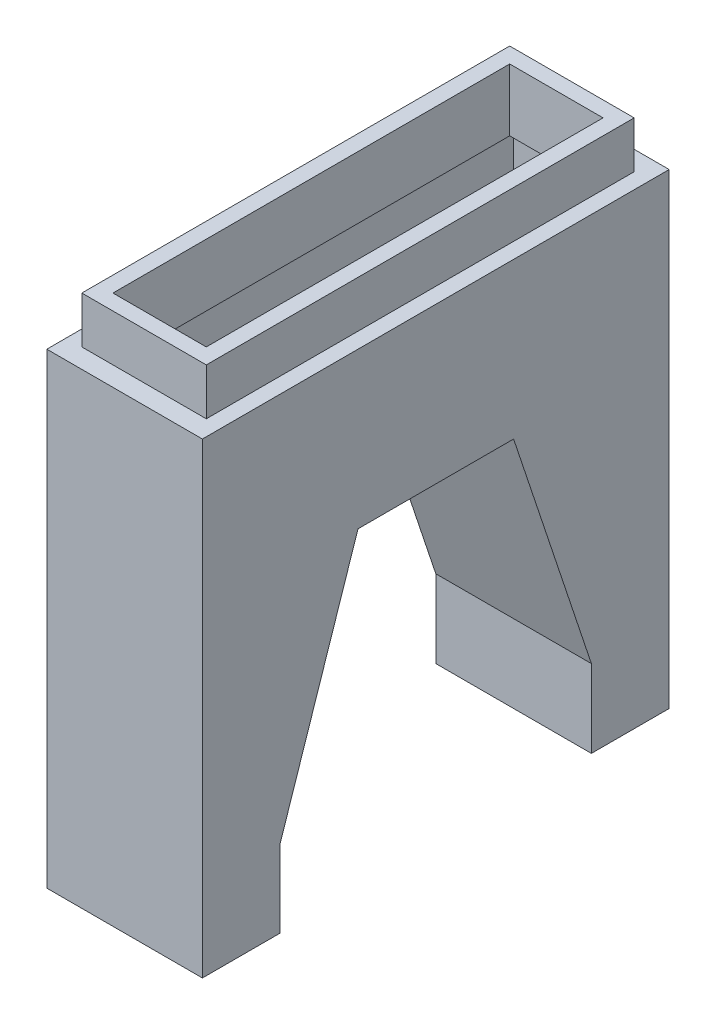
from build123d import *

# Parameters (mm, degrees)
SKETCH1_W           = 8
SKETCH1_H           = 27.5
BOSS_EXTRUDE1_DEPTH = 3
SKETCH2_W           = 10
SKETCH2_H           = 30
BOSS_EXTRUDE2_DEPTH = 10
SKETCH4_W           = 10
SKETCH4_H           = 5
BOSS_EXTRUDE3_DEPTH = 20
CHAMFER2_SIZE       = 5
CHAMFER2_SIZE2      = 15
SKETCH7_W           = 4
SKETCH7_H           = 5
CUT_EXTRUDE2_DEPTH  = 2
SHELL1_START        = -4
SHELL1_DEPTH        = 8
SHELL1_START_2      = -3
SHELL1_2_OUTLINE_W  = 4
SHELL1_2_OUTLINE_H  = 25.5
SHELL1_2_DEPTH      = 6
SHELL1_START_3      = -1
SHELL1_3_DEPTH      = 5


# Read off the part's stored shape, not the designer's step: Shell1
with BuildPart() as part:
    # Sketch1 → Boss-Extrude1 (new body)
    with BuildSketch(Plane(origin=(0, 0, 0), x_dir=(1, 0, 0), z_dir=(0, 1, 0))):
        Rectangle(SKETCH1_W, SKETCH1_H)
    extrude(amount=BOSS_EXTRUDE1_DEPTH)

    # Sketch2 → Boss-Extrude2 (add)
    with BuildSketch(Plane.XZ):
        Rectangle(SKETCH2_W, SKETCH2_H)
    extrude(amount=BOSS_EXTRUDE2_DEPTH)

    # Sketch4 → Boss-Extrude3 (add)
    with BuildSketch(Plane.XZ.offset(10)):
        with Locations((0, 12.5)):
            Rectangle(SKETCH4_W, SKETCH4_H)
        with Locations((0, -12.5)):
            Rectangle(SKETCH4_W, SKETCH4_H)
    extrude(amount=BOSS_EXTRUDE3_DEPTH)

    # Chamfer2
    chamfer2_edges = [part.edges().sort_by_distance(p)[0] for p in [
        (0, -10, 10),
        (0, -10, -10),
    ]]
    chamfer2_side = [part.faces().sort_by_distance(p)[0] for p in [
        (0, -10, 0),
    ]]
    chamfer(chamfer2_edges, length=CHAMFER2_SIZE, length2=CHAMFER2_SIZE2, reference=chamfer2_side[0])

    # Sketch7 → Cut-Extrude2 (cut)
    with BuildSketch(Plane(origin=(0, 0, 10), x_dir=(-1, 0, 0), z_dir=(0, 0, -1))):
        with Locations((3, -27.5)):
            Rectangle(SKETCH7_W, SKETCH7_H)
    extrude(amount=-CUT_EXTRUDE2_DEPTH, mode=Mode.SUBTRACT)

    # Shell1 outline → Shell1 (cut)
    with BuildSketch(Plane.YZ.offset(SHELL1_START)):
        Polygon((-9, 5.72075922), (-9, -5.72075922), (-24.83772234, -11), (-29, -11), (-29, -14), (-1, -14), (-1, 14), (-29, 14), (-29, 11), (-25, 11), (-25, 11.054092553), align=None)
    extrude(amount=SHELL1_DEPTH, mode=Mode.SUBTRACT)

    # Shell1 2 outline → Shell1 2 (cut)
    with BuildSketch(Plane.YZ.offset(SHELL1_START_2)):
        with Locations((1, 0)):
            Rectangle(SHELL1_2_OUTLINE_W, SHELL1_2_OUTLINE_H)
    extrude(amount=SHELL1_2_DEPTH, mode=Mode.SUBTRACT)

    # Shell1 3 outline → Shell1 3 (cut)
    with BuildSketch(Plane.YZ.offset(SHELL1_START_3)):
        Polygon((-25, 11), (-24.83772234, 11), (-25, 11.054092553), align=None)
    extrude(amount=SHELL1_3_DEPTH, mode=Mode.SUBTRACT)


solid = part.part
